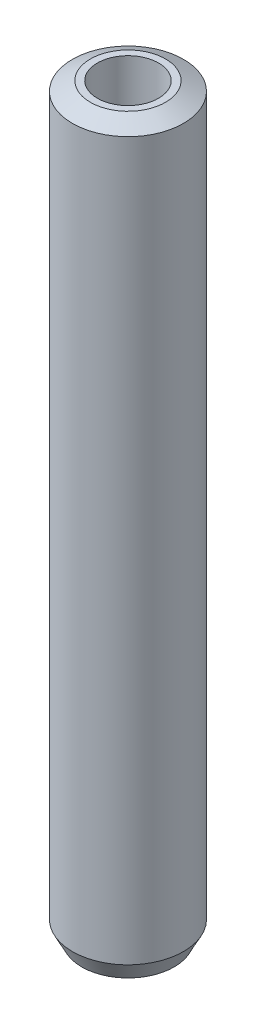
from build123d import *
from OCP.BRepFilletAPI import BRepFilletAPI_MakeChamfer

# Parameters (mm, degrees)
SKETCH1_R           = 22.5
BOSS_EXTRUDE1_DEPTH = 301.557135636
SKETCH2_R           = 12.393922126
CUT_EXTRUDE1_DEPTH  = 304.23127486
CHAMFER1_SIZE       = 3.761865239
CHAMFER1_SIZE2      = 7.279964169


with BuildPart() as part:
    # Sketch1 → Boss-Extrude1 (new body)
    with BuildSketch(Plane(origin=(0, 0, 0), x_dir=(1, 0, 0), z_dir=(0, 1, 0))):
        Circle(SKETCH1_R)
    extrude(amount=BOSS_EXTRUDE1_DEPTH)

    # Sketch2 → Cut-Extrude1 (cut, through all)
    with BuildSketch(Plane(origin=(0, 0, 0), x_dir=(1, 0, 0), z_dir=(0, 1, 0))):
        Circle(SKETCH2_R)
    extrude(amount=CUT_EXTRUDE1_DEPTH, mode=Mode.SUBTRACT)

    # Chamfer1: one chamfer whose edges measure the first distance from different faces: ONE call of the kernel's chamfer builder (chamfer() names one face for all edges)
    chamfer1_edges_1 = [part.edges().sort_by_distance(p)[0] for p in [
        (-22.5, 301.557135636, 0),
    ]]
    chamfer1_side_1 = [part.faces().sort_by_distance(p)[0] for p in [
        (-22.5, 150.778567818, 0),
    ]]
    chamfer1_edges_2 = [part.edges().sort_by_distance(p)[0] for p in [
        (-22.5, 0, 0),
    ]]
    chamfer1_side_2 = [part.faces().sort_by_distance(p)[0] for p in [
        (-21.863603897, 0, 0),
    ]]
    chamfer1 = BRepFilletAPI_MakeChamfer(part.part.solid().wrapped)
    for e in chamfer1_edges_1:
        chamfer1.Add(CHAMFER1_SIZE, CHAMFER1_SIZE2, e.wrapped, chamfer1_side_1[0].wrapped)  # the first distance lies on this face
    for e in chamfer1_edges_2:
        chamfer1.Add(CHAMFER1_SIZE, CHAMFER1_SIZE2, e.wrapped, chamfer1_side_2[0].wrapped)  # the first distance lies on this face
    add(Compound.cast(chamfer1.Shape()), mode=Mode.REPLACE)


solid = part.part
